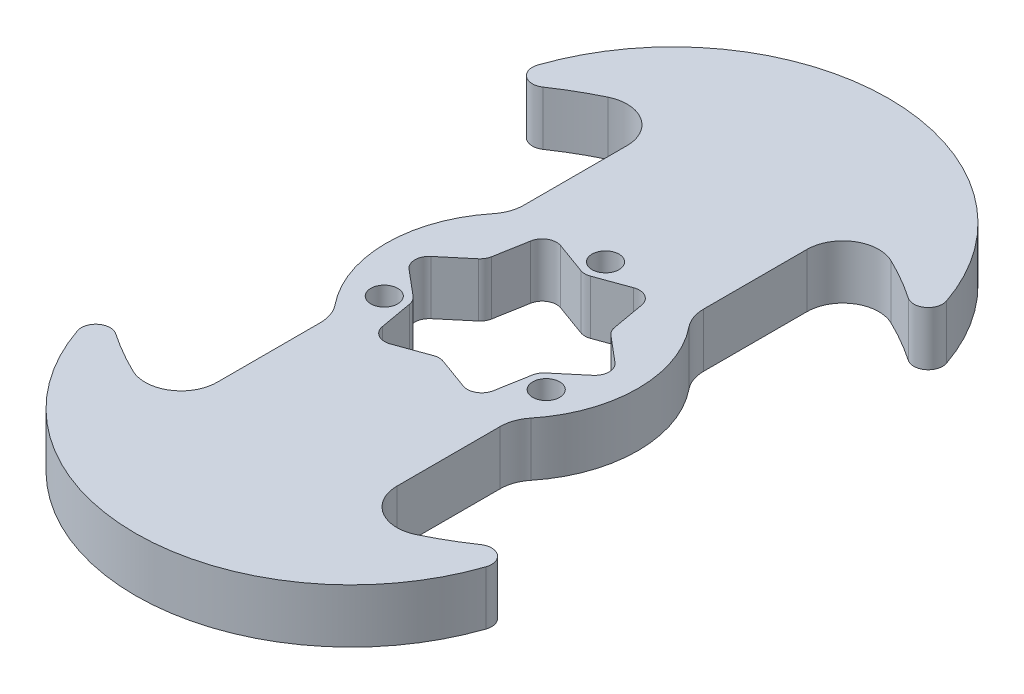
from build123d import *

# Parameters (mm, degrees)
SKETCH1_R           = 2.38125
BOSS_EXTRUDE1_DEPTH = 9.525


with BuildPart() as part:
    # Sketch1 → Boss-Extrude1 (new body)
    with BuildSketch(Plane(origin=(0, 0, 0), x_dir=(1, 0, 0), z_dir=(0, 1, 0))):
        with BuildLine():
            Line((-15.875, 36.19521943), (-15.875, 17.960512242))
            ThreePointArc((-15.875, 17.960512242), (-16.238162586, 15.843845575), (-17.286111111, 13.969287299))
            ThreePointArc((-17.286111111, 13.969287299), (-22.225, 0), (-17.286111111, -13.969287299))
            ThreePointArc((-17.286111111, -13.969287299), (-16.238162586, -15.843845575), (-15.875, -17.960512242))
            Line((-15.875, -17.960512242), (-15.875, -36.19521943))
            ThreePointArc((-15.875, -36.19521943), (-18.852383507, -41.575550088), (-24.992467084, -41.910429483))
            ThreePointArc((-24.992467084, -41.910429483), (-28.697029693, -39.946251764), (-32.248166302, -37.716631386))
            ThreePointArc((-32.248166302, -37.716631386), (-35.214207993, -37.795292189), (-36.081994834, -40.632638984))
            ThreePointArc((-36.081994834, -40.632638984), (0, -66.4974582), (36.081994834, -40.632638984))
            ThreePointArc((36.081994834, -40.632638984), (35.214207993, -37.795292189), (32.248166302, -37.716631386))
            ThreePointArc((32.248166302, -37.716631386), (28.697029693, -39.946251764), (24.992467084, -41.910429483))
            ThreePointArc((24.992467084, -41.910429483), (18.852383507, -41.575550088), (15.875, -36.19521943))
            Line((15.875, -36.19521943), (15.875, -17.960512242))
            ThreePointArc((15.875, -17.960512242), (16.238162586, -15.843845575), (17.286111111, -13.969287299))
            ThreePointArc((17.286111111, -13.969287299), (22.225, 0), (17.286111111, 13.969287299))
            ThreePointArc((17.286111111, 13.969287299), (16.238162586, 15.843845575), (15.875, 17.960512242))
            Line((15.875, 17.960512242), (15.875, 36.19521943))
            ThreePointArc((15.875, 36.19521943), (18.852383507, 41.575550088), (24.992467084, 41.910429483))
            ThreePointArc((24.992467084, 41.910429483), (28.697029693, 39.946251764), (32.248166302, 37.716631386))
            ThreePointArc((32.248166302, 37.716631386), (35.214207993, 37.795292189), (36.081994834, 40.632638984))
            ThreePointArc((36.081994834, 40.632638984), (0, 66.4974582), (-36.081994834, 40.632638984))
            ThreePointArc((-36.081994834, 40.632638984), (-35.214207993, 37.795292189), (-32.248166302, 37.716631386))
            ThreePointArc((-32.248166302, 37.716631386), (-28.697029693, 39.946251764), (-24.992467084, 41.910429483))
            ThreePointArc((-24.992467084, 41.910429483), (-18.852383507, 41.575550088), (-15.875, 36.19521943))
        make_face()
        with Locations((-14.298079416, -8.255)):
            Circle(SKETCH1_R, mode=Mode.SUBTRACT)
        with Locations((0, 16.51)):
            Circle(SKETCH1_R, mode=Mode.SUBTRACT)
        with Locations((14.298079416, -8.255)):
            Circle(SKETCH1_R, mode=Mode.SUBTRACT)
        with BuildLine():
            Line((6.435925078, 15.035903984), (0.872893577, 13.016814686))
            ThreePointArc((0.872893577, 13.016814686), (0.006721965, 12.862124307), (-0.860256267, 13.012228004))
            Line((-0.860256267, 13.012228004), (-6.435925078, 15.035903984))
            ThreePointArc((-6.435925078, 15.035903984), (-8.572500239, 14.848004066), (-9.803511258, 13.09162379))
            Line((-9.803511258, 13.09162379), (-10.83761762, 7.257733753))
            ThreePointArc((-10.83761762, 7.257733753), (-11.138925375, 6.431059337), (-11.704192542, 5.756781959))
            Line((-11.704192542, 5.756781959), (-16.239436336, 1.944274561))
            ThreePointArc((-16.239436336, 1.944274561), (-17.144998978, -2.816e-06), (-16.239436336, -1.944280194))
            Line((-16.239436336, -1.944280194), (-11.704192542, -5.756787592))
            ThreePointArc((-11.704192542, -5.756787592), (-11.138925375, -6.43106497), (-10.83761762, -7.257739386))
            Line((-10.83761762, -7.257739386), (-9.803511258, -13.091629423))
            ThreePointArc((-9.803511258, -13.091629423), (-8.572498978, -14.848008364), (-6.435924056, -15.035906801))
            Line((-6.435924056, -15.035906801), (-0.859723128, -13.01203769))
            ThreePointArc((-0.859723128, -13.01203769), (0.006721965, -12.862125742), (0.872361459, -13.016621555))
            Line((0.872361459, -13.016621555), (6.435925078, -15.035903984))
            ThreePointArc((6.435925078, -15.035903984), (8.5725, -14.848005548), (9.80351228, -13.091626607))
            Line((9.80351228, -13.091626607), (10.837618642, -7.257736569))
            ThreePointArc((10.837618642, -7.257736569), (11.138927312, -6.431063562), (11.704194586, -5.756787592))
            Line((11.704194586, -5.756787592), (16.239438381, -1.944280194))
            ThreePointArc((16.239438381, -1.944280194), (17.145001022, -2.816e-06), (16.239438381, 1.944274561))
            Line((16.239438381, 1.944274561), (11.704194586, 5.756781959))
            ThreePointArc((11.704194586, 5.756781959), (11.138926421, 6.431060518), (10.837618642, 7.257736569))
            Line((10.837618642, 7.257736569), (9.80351228, 13.091626607))
            ThreePointArc((9.80351228, 13.091626607), (8.5725, 14.848005548), (6.435925078, 15.035903984))
        make_face(mode=Mode.SUBTRACT)
    extrude(amount=BOSS_EXTRUDE1_DEPTH)


solid = part.part
